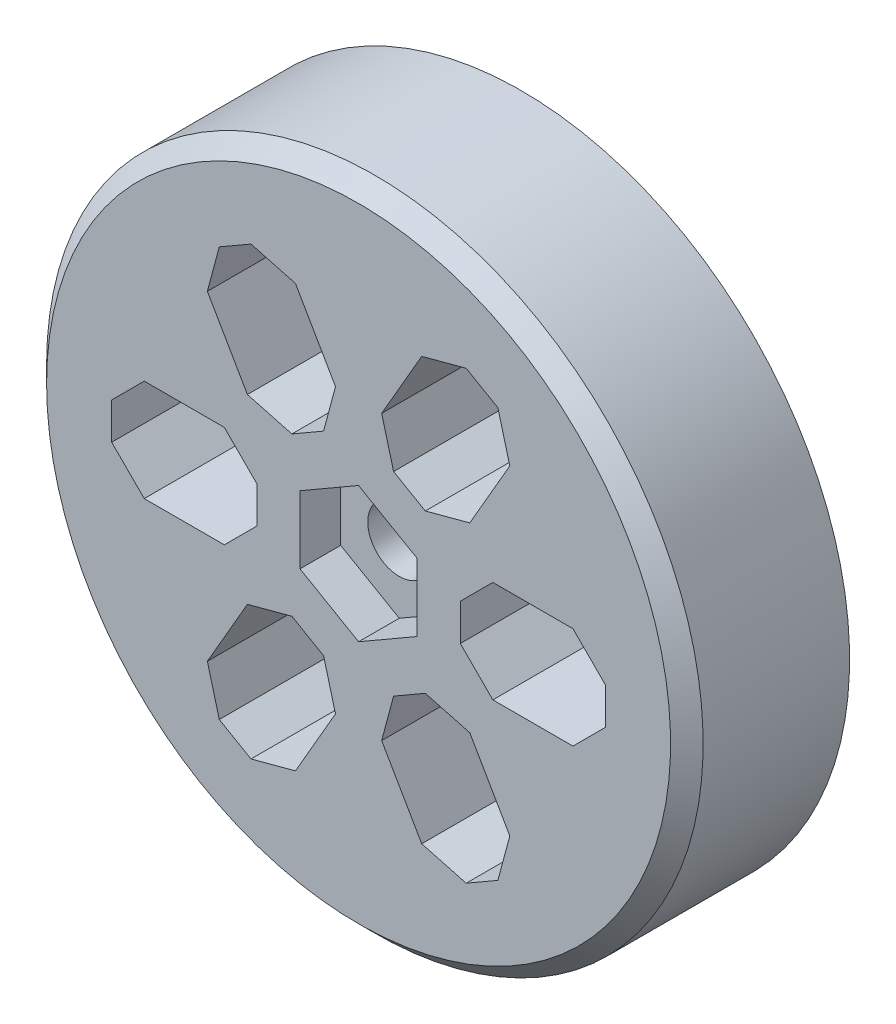
from build123d import *

# Parameters (mm, degrees)
SKETCH1_R               = 25.6159
BOSS_EXTRUDE1_DEPTH     = 12.7
CHAMFER1_SIZE           = 1.27
CUT_EXTRUDE1_DEPTH      = 3.175
F_8_CLEARANCE_HOLE1_D   = 4.9149
SKETCH5_W               = 11.3284
SKETCH5_H               = 7.9375
CUT_EXTRUDE_THIN1_DEPTH = 39.388001584
CHAMFER2_SIZE           = 2.54


with BuildPart() as part:
    # Sketch1 → Boss-Extrude1 (new body)
    with BuildSketch(Plane.XY):
        Circle(SKETCH1_R)
    extrude(amount=BOSS_EXTRUDE1_DEPTH)

    # Chamfer1
    chamfer1_edges = [part.edges().sort_by_distance(p)[0] for p in [
        (-25.6159, 0, 12.7),
    ]]
    chamfer(chamfer1_edges, length=CHAMFER1_SIZE)

    # Sketch2 → Cut-Extrude1 (cut)
    with BuildSketch(Plane.XY.offset(12.7)):
        Polygon((-4.572, -2.639645431), (0, -5.279290861), (4.572, -2.639645431), (4.572, 2.639645431), (0, 5.279290861), (-4.572, 2.639645431), align=None)
    extrude(amount=-CUT_EXTRUDE1_DEPTH, mode=Mode.SUBTRACT)

    # #8 Clearance Hole1 (through all)
    with Locations(Plane.XY.offset(12.7)):
        with Locations((0, 0)):
            Hole(F_8_CLEARANCE_HOLE1_D / 2)

    # Sketch5 → Cut-Extrude-Thin1 (cut, through all)
    with BuildSketch(Plane.XY.offset(12.7)):
        Polygon((-7.405788321, -4.889701643), (-13.069988321, -14.700383827), (-6.195911679, -18.669133827), (-0.531711679, -8.858451643), align=None)
        with Locations((-13.6017, 0)):
            Rectangle(SKETCH5_W, SKETCH5_H)
        Polygon((-0.531711679, 8.858451643), (-6.195911679, 18.669133827), (-13.069988321, 14.700383827), (-7.405788321, 4.889701643), align=None)
        Polygon((7.405788321, 4.889701643), (13.069988321, 14.700383827), (6.195911679, 18.669133827), (0.531711679, 8.858451643), align=None)
        with Locations((13.6017, 0)):
            Rectangle(SKETCH5_W, SKETCH5_H)
        Polygon((0.531711679, -8.858451643), (6.195911679, -18.669133827), (13.069988321, -14.700383827), (7.405788321, -4.889701643), align=None)
    extrude(amount=-CUT_EXTRUDE_THIN1_DEPTH, mode=Mode.SUBTRACT)

    # Chamfer2
    chamfer2_edges = [part.edges().sort_by_distance(p)[0] for p in [
        (-13.069988321, -14.700383827, 6.35),
        (-6.195911679, -18.669133827, 6.35),
        (-7.405788321, -4.889701643, 6.35),
        (-0.531711679, -8.858451643, 6.35),
        (0.531711679, -8.858451643, 6.35),
        (6.195911679, -18.669133827, 6.35),
        (13.069988321, -14.700383827, 6.35),
        (7.405788321, -4.889701643, 6.35),
        (19.2659, 3.96875, 6.35),
        (19.2659, -3.96875, 6.35),
        (7.9375, -3.96875, 6.35),
        (7.9375, 3.96875, 6.35),
        (6.195911679, 18.669133827, 6.35),
        (0.531711679, 8.858451643, 6.35),
        (7.405788321, 4.889701643, 6.35),
        (13.069988321, 14.700383827, 6.35),
        (-13.069988321, 14.700383827, 6.35),
        (-7.405788321, 4.889701643, 6.35),
        (-0.531711679, 8.858451643, 6.35),
        (-6.195911679, 18.669133827, 6.35),
        (-19.2659, 3.96875, 6.35),
        (-19.2659, -3.96875, 6.35),
        (-7.9375, -3.96875, 6.35),
        (-7.9375, 3.96875, 6.35),
    ]]
    chamfer(chamfer2_edges, length=CHAMFER2_SIZE)


solid = part.part
